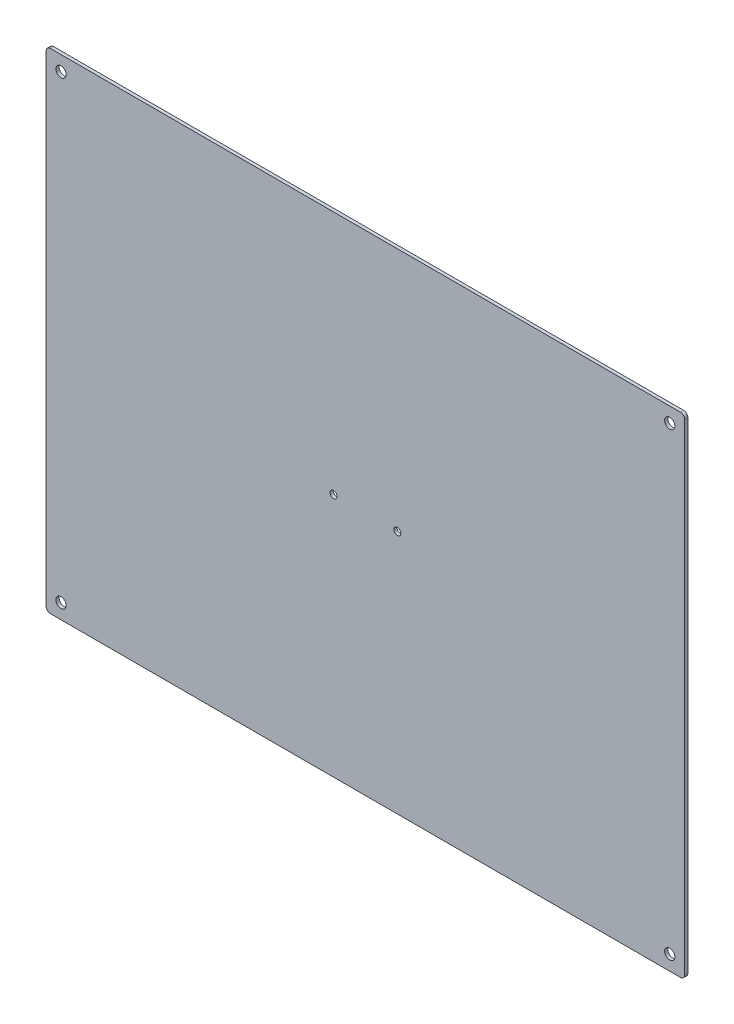
from build123d import *

# Parameters (mm, degrees)
SKETCH_1_W             = 300
SKETCH_1_H             = 230
SM_BASE_FLANGE_1_DEPTH = 1.5
HOLE_WIZARD_M4_1_D     = 4.8
HOLE_WIZARD_M4_1_2_D   = 3.3
OTHER_START            = -2
OTHER_1_DEPTH          = 3


with BuildPart() as part:
    # 基体-法兰1: sheet metal written as solids
    # Sketch 1 → 基体-法兰1 (new body)
    with BuildSketch(Plane.XY):
        Rectangle(SKETCH_1_W, SKETCH_1_H)
    extrude(amount=-SM_BASE_FLANGE_1_DEPTH)

    # Hole Wizard M4 _1 (through all)
    with Locations(Plane.XY):
        with Locations((-143, 108), (143, 108), (143, -108), (-143, -108)):
            Hole(HOLE_WIZARD_M4_1_D / 2)

    # Hole Wizard M4 _1 2 (through all)
    with Locations(Plane.XY):
        with Locations((-15, 0), (15, 0)):
            Hole(HOLE_WIZARD_M4_1_2_D / 2)

    # Other 1: read off the stored shape, not the designer's step
    # Other 1 outline → Other 1 (cut)
    with BuildSketch(Plane.XY.offset(OTHER_START)):
        with BuildLine():
            ThreePointArc((150, -113), (149.414213562, -114.414213562), (148, -115))
            Line((148, -115), (150, -115))
            Line((150, -115), (150, -113))
        make_face()
        with BuildLine():
            Line((-150, -115), (-148, -115))
            ThreePointArc((-148, -115), (-149.414213562, -114.414213562), (-150, -113))
            Line((-150, -113), (-150, -115))
        make_face()
        with BuildLine():
            ThreePointArc((148, 115), (149.414213562, 114.414213562), (150, 113))
            Line((150, 113), (150, 115))
            Line((150, 115), (148, 115))
        make_face()
        with BuildLine():
            Line((-150, 115), (-150, 113))
            ThreePointArc((-150, 113), (-149.414213562, 114.414213562), (-148, 115))
            Line((-148, 115), (-150, 115))
        make_face()
    extrude(amount=OTHER_1_DEPTH, mode=Mode.SUBTRACT)


solid = part.part
